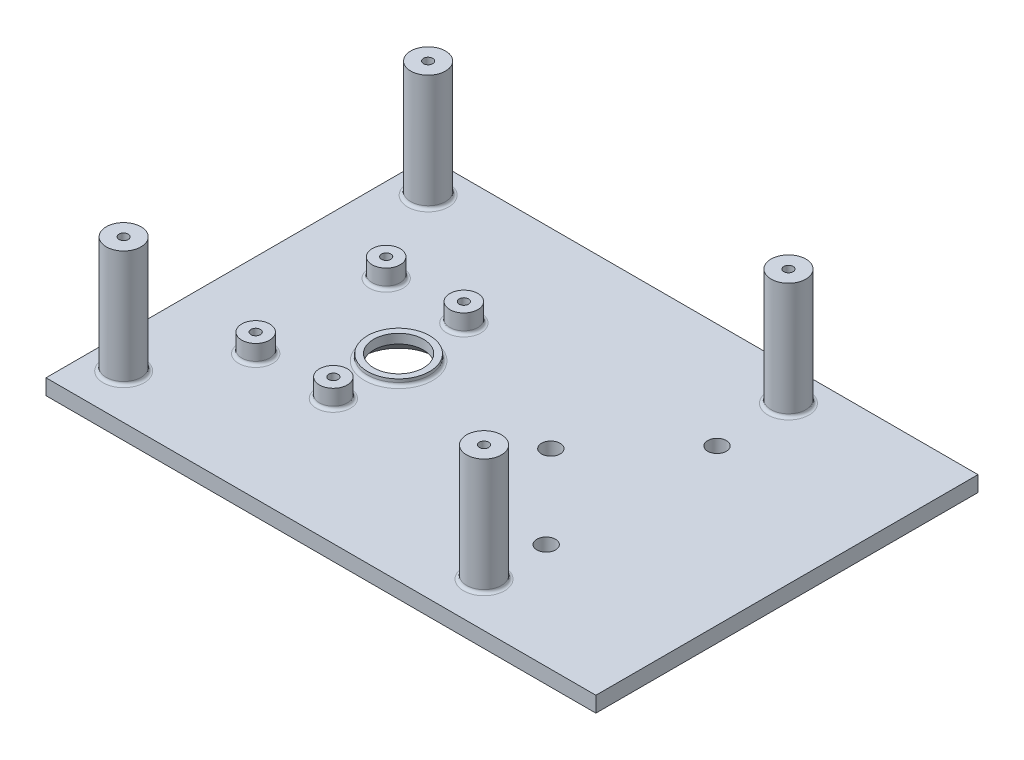
from build123d import *

# Parameters (mm, degrees)
SKETCH1_W             = 88.5
SKETCH1_H             = 61.5
BOSS_EXTRUDE1_DEPTH   = 2.5
SKETCH1_3_R           = 2.8
BOSS_EXTRUDE2_DEPTH   = 21.2
SKETCH3_R             = 5
SKETCH3_R_2           = 4
BOSS_EXTRUDE3_DEPTH   = 1
SKETCH3_4_R           = 2.25
SKETCH3_4_R_2         = 0.75
BOSS_EXTRUDE4_DEPTH   = 3
CUT_EXTRUDE3_START    = -10
SKETCH3_5_R           = 4
CUT_EXTRUDE3_DEPTH    = 10
CHAMFER1_SIZE         = 2
SKETCH4_R             = 0.75
CUT_EXTRUDE4_DEPTH    = 5
FILLET1_R             = 0.5
F_3_0MM_DOWEL_HOLE1_D = 3


with BuildPart() as part:
    # Sketch1 → Boss-Extrude1 (new body)
    with BuildSketch(Plane(origin=(0, 0, 0), x_dir=(1, 0, 0), z_dir=(0, 1, 0))):
        with Locations((0, 30.75)):
            Rectangle(SKETCH1_W, SKETCH1_H)
    extrude(amount=BOSS_EXTRUDE1_DEPTH)

    # Sketch1<3> → Boss-Extrude2 (add)
    with BuildSketch(Plane(origin=(0, 0, 0), x_dir=(1, 0, 0), z_dir=(0, 1, 0))):
        with Locations(Location((-38.95, 56.2, 0), (0, 0, 90))):
            Circle(SKETCH1_3_R)
        with Locations(Location((-38.95, 7.2, 0), (0, 0, 90))):
            Circle(SKETCH1_3_R)
        with Locations(Location((19.05, 7.2, 0), (0, 0, 90))):
            Circle(SKETCH1_3_R)
        with Locations(Location((19.05, 56.2, 0), (0, 0, 90))):
            Circle(SKETCH1_3_R)
    extrude(amount=BOSS_EXTRUDE2_DEPTH)

    # Sketch3 → Boss-Extrude3 (add)
    with BuildSketch(Plane(origin=(0, 2.5, 0), x_dir=(1, 0, 0), z_dir=(0, 1, 0))):
        with Locations(Location((-18.25, 30.75, 0), (0, 0, 90))):
            Circle(SKETCH3_R)
        with Locations(Location((-18.25, 30.75, 0), (0, 0, 270))):
            Circle(SKETCH3_R_2, mode=Mode.SUBTRACT)
    extrude(amount=BOSS_EXTRUDE3_DEPTH)

    # Sketch3<4> → Boss-Extrude4 (add)
    # profile 1 of 4: a face of its own
    with BuildSketch(Plane(origin=(0, 2.5, 0), x_dir=(1, 0, 0), z_dir=(0, 1, 0))):
        with Locations(Location((-18.25, 41.25, 0), (0, 0, 90))):
            Circle(SKETCH3_4_R)
        with Locations(Location((-18.25, 41.25, 0), (0, 0, 270))):
            Circle(SKETCH3_4_R_2, mode=Mode.SUBTRACT)
    # profile 2 of 4: a face of its own
    with BuildSketch(Plane(origin=(0, 2.5, 0), x_dir=(1, 0, 0), z_dir=(0, 1, 0))):
        with Locations(Location((-18.25, 20.25, 0), (0, 0, 90))):
            Circle(SKETCH3_4_R)
        with Locations(Location((-18.25, 20.25, 0), (0, 0, 270))):
            Circle(SKETCH3_4_R_2, mode=Mode.SUBTRACT)
    # profile 3 of 4: a face of its own
    with BuildSketch(Plane(origin=(0, 2.5, 0), x_dir=(1, 0, 0), z_dir=(0, 1, 0))):
        with Locations(Location((-30.75, 41.25, 0), (0, 0, 90))):
            Circle(SKETCH3_4_R)
        with Locations(Location((-30.75, 41.25, 0), (0, 0, 270))):
            Circle(SKETCH3_4_R_2, mode=Mode.SUBTRACT)
    # profile 4 of 4: a face of its own
    with BuildSketch(Plane(origin=(0, 2.5, 0), x_dir=(1, 0, 0), z_dir=(0, 1, 0))):
        with Locations(Location((-30.75, 20.25, 0), (0, 0, 90))):
            Circle(SKETCH3_4_R)
        with Locations(Location((-30.75, 20.25, 0), (0, 0, 270))):
            Circle(SKETCH3_4_R_2, mode=Mode.SUBTRACT)
    extrude(amount=BOSS_EXTRUDE4_DEPTH)

    # Sketch3<5> → Cut-Extrude3 (cut)
    with BuildSketch(Plane(origin=(0, 2.5, 0), x_dir=(1, 0, 0), z_dir=(0, 1, 0)).offset(CUT_EXTRUDE3_START)):
        with Locations(Location((-18.25, 30.75, 0), (0, 0, 90))):
            Circle(SKETCH3_5_R)
    extrude(amount=CUT_EXTRUDE3_DEPTH, mode=Mode.SUBTRACT)

    # Chamfer1
    # the kernel refuses this chamfer: 2 mm, written as the material it takes off along each edge
    with BuildSketch(Plane(origin=(-18.25, 0, -30.75), x_dir=(0, 0, -1), z_dir=(-1, 0, 0))) as chamfer1_piece_1:
        Polygon((4 + CHAMFER1_SIZE, 0), (4, -CHAMFER1_SIZE), (4, 0), align=None)
    revolve(axis=Axis((-18.25, 0, -30.75), (0, -1, 0)), mode=Mode.SUBTRACT)

    # Sketch4 → Cut-Extrude4 (cut)
    with BuildSketch(Plane(origin=(0, 21.2, 0), x_dir=(1, 0, 0), z_dir=(0, 1, 0))):
        with Locations(Location((-38.95, 56.2, 0), (0, 0, 270))):
            Circle(SKETCH4_R)
        with Locations(Location((19.05, 56.2, 0), (0, 0, 270))):
            Circle(SKETCH4_R)
        with Locations(Location((-38.95, 7.2, 0), (0, 0, 270))):
            Circle(SKETCH4_R)
        with Locations(Location((19.05, 7.2, 0), (0, 0, 270))):
            Circle(SKETCH4_R)
    extrude(amount=-CUT_EXTRUDE4_DEPTH, mode=Mode.SUBTRACT)

    # Fillet1
    fillet1_edges = [part.edges().sort_by_distance(p)[0] for p in [
        (-38.95, 2.5, -4.4),
        (-38.95, 2.5, -53.4),
        (19.05, 2.5, -53.4),
        (19.05, 2.5, -4.4),
        (-18.25, 2.5, -25.75),
        (-18.25, 2.5, -18),
        (-30.75, 2.5, -39),
        (-18.25, 2.5, -39),
        (-30.75, 2.5, -18),
    ]]
    fillet(fillet1_edges, radius=FILLET1_R)

    # Ø3.0mm Dowel Hole1 (through all)
    with Locations(Plane(origin=(0, 0, 0), x_dir=(-1, 0, 0), z_dir=(0, -1, 0))):
        with Locations((-19.25, 44.5), (-19.25, 17), (-6.25, 30.75)):
            Hole(F_3_0MM_DOWEL_HOLE1_D / 2)


solid = part.part
